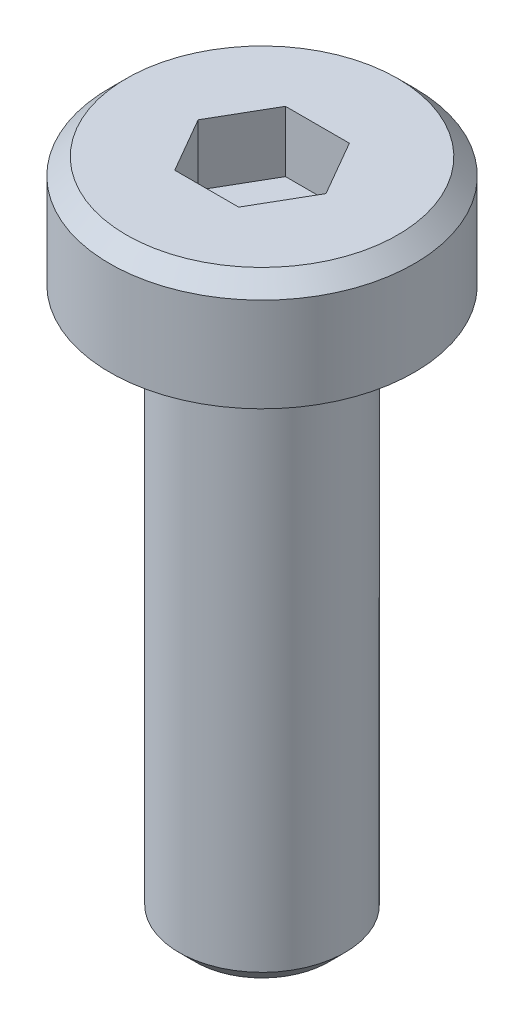
from build123d import *

# Parameters (mm, degrees)
CUT_EXTRUDE_322_DEPTH = 1.1


with BuildPart() as part:
    # Sketch 184 → Revolve 223 (revolve)
    with BuildSketch(Plane.XY):
        Polygon((0, -10), (1.2, -10), (1.5, -9.7), (1.5, 0), (2.75, 0), (2.75, 1.7), (2.45, 2), (0, 2), align=None)
    revolve(axis=Axis((0, -12, 0), (0, 1, 0)))

    # Sketch 274 → Cut-Extrude 322 (cut)
    with BuildSketch(Plane(origin=(0, 2, 0), x_dir=(1, 0, 0), z_dir=(0, 1, 0))):
        Polygon((1.154700538, 0), (0.577350269, 1), (-0.577350269, 1), (-1.154700538, 0), (-0.577350269, -1), (0.577350269, -1), align=None)
    extrude(amount=-CUT_EXTRUDE_322_DEPTH, mode=Mode.SUBTRACT)


solid = part.part
